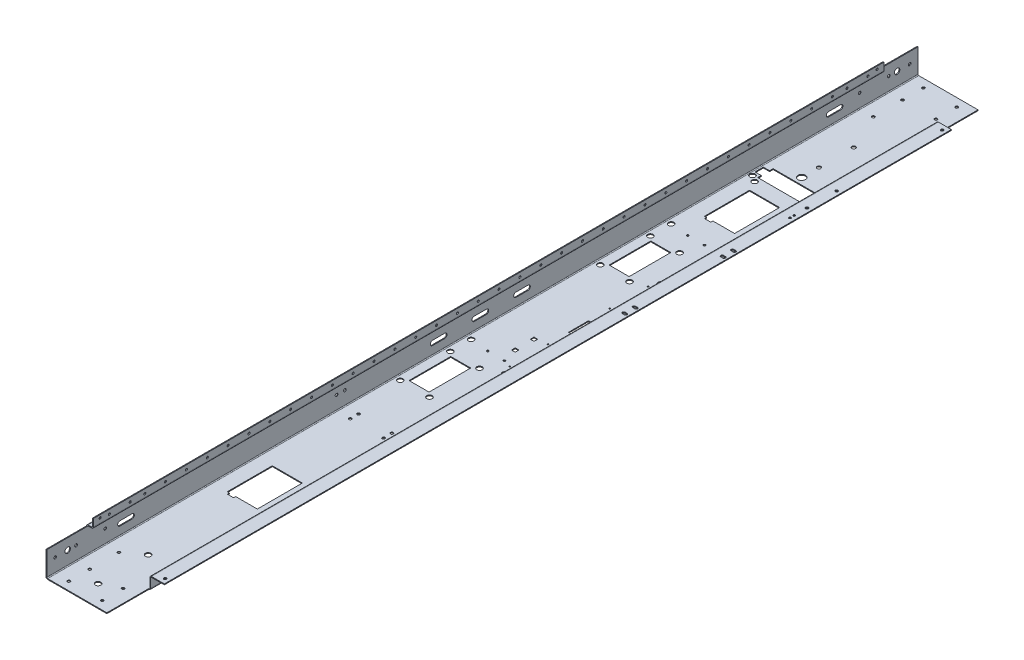
from build123d import *

# Parameters (mm, degrees)
SM_BASE_FLANGE_1_DEPTH    = 1045
SKETCH_6_W                = 101
SKETCH_6_H                = 30
CUT_EXTRUDE_1_DEPTH       = 37
SKETCH_7_W                = 17
SKETCH_7_H                = 97
CUT_EXTRUDE_2_DEPTH       = 24
SKETCH_8_R                = 6.5
SKETCH_8_R_2              = 3.25
CUT_EXTRUDE_3_DEPTH       = 10
SKETCH_9_R                = 3.25
CUT_EXTRUDE_4_DEPTH       = 10
SKETCH_13_R               = 3.25
CUT_EXTRUDE_6_DEPTH       = 10
CUT_EXTRUDE_7_DEPTH       = 10
CUT_EXTRUDE_8_DEPTH       = 10
SKETCH_16_R               = 3.25
SKETCH_16_R_2             = 6.5
CUT_EXTRUDE_9_DEPTH       = 10
SKETCH_17_R               = 2.5
CUT_EXTRUDE_10_DEPTH      = 10
MOVE_BODY_1_OUTLINE_R     = 3.25
MOVE_BODY_1_DEPTH         = 2
MOVE_START                = -28
MOVE_BODY_1_2_OUTLINE_R   = 6.5
MOVE_BODY_1_2_OUTLINE_R_2 = 3.25
MOVE_BODY_1_2_DEPTH       = 2
MOVE_START_2              = -183
MOVE_BODY_1_3_OUTLINE_R   = 3.25
MOVE_BODY_1_3_DEPTH       = 2
MOVE_BODY_1_4_OUTLINE_R   = 6.5
MOVE_BODY_1_4_OUTLINE_R_2 = 3.25
MOVE_BODY_1_4_DEPTH       = 30
MOVE_BODY_1_5_OUTLINE_R   = 3.25
MOVE_BODY_1_5_DEPTH       = 2
SKETCH_18_W               = 72
SKETCH_18_H               = 108
SKETCH_18_W_2             = 15
SKETCH_18_H_2             = 5
CUT_EXTRUDE_6828_DEPTH    = 10
SKETCH_21_R               = 6.5
CUT_EXTRUDE_7582_DEPTH    = 10
SKETCH_27_R               = 2.5
CUT_EXTRUDE_8046_DEPTH    = 10
SKETCH_32_R               = 6.5
SKETCH_32_W               = 48
SKETCH_32_H               = 100
CUT_EXTRUDE_9018_DEPTH    = 10
SKETCH_33_R               = 1.65
SKETCH_33_R_2             = 6.5
SKETCH_33_W               = 20
SKETCH_33_H               = 48
CUT_EXTRUDE_10405_DEPTH   = 10
SKETCH_34_W               = 9
SKETCH_34_H               = 9
CUT_EXTRUDE_10720_DEPTH   = 10
SKETCH_35_R               = 6.5
CUT_EXTRUDE_10935_DEPTH   = 10
SKETCH_36_R               = 4.5
SKETCH_36_R_2             = 9
CUT_EXTRUDE_11210_DEPTH   = 10
CUT_EXTRUDE_12065_DEPTH   = 10
SKETCH_38_R               = 2.5
CUT_EXTRUDE_12355_DEPTH   = 10


# Read off the part's stored shape, not the designer's step: Тело-Переместить/Копировать1
# Sheet-metal steps are written as plain solids
with BuildPart() as part:
    # Sketch 1 → Sm Base Flange 1 (new, symmetric)
    with BuildSketch(Plane.XY):
        with BuildLine():
            Line((0, 0), (-31, 0))
            ThreePointArc((-31, 0), (-32.414213562, -0.585786438), (-33, -2))
            Line((-33, -2), (-33, -24))
            ThreePointArc((-33, -24), (-34.171572875, -26.828427125), (-37, -28))
            Line((-37, -28), (-179, -28))
            ThreePointArc((-179, -28), (-181.828427125, -26.828427125), (-183, -24))
            Line((-183, -24), (-183, 33))
            ThreePointArc((-183, 33), (-181.828427125, 35.828427125), (-179, 37))
            Line((-179, 37), (-170, 37))
            ThreePointArc((-170, 37), (-168.585786438, 37.585786438), (-168, 39))
            Line((-168, 39), (-168, 57))
            Line((-168, 57), (-166, 57))
            Line((-166, 57), (-166, 39))
            ThreePointArc((-166, 39), (-167.171572875, 36.171572875), (-170, 35))
            Line((-170, 35), (-179, 35))
            ThreePointArc((-179, 35), (-180.414213562, 34.414213562), (-181, 33))
            Line((-181, 33), (-181, -24))
            ThreePointArc((-181, -24), (-180.414213562, -25.414213562), (-179, -26))
            Line((-179, -26), (-37, -26))
            ThreePointArc((-37, -26), (-35.585786438, -25.414213562), (-35, -24))
            Line((-35, -24), (-35, -2))
            ThreePointArc((-35, -2), (-33.828427125, 0.828427125), (-31, 2))
            Line((-31, 2), (0, 2))
            Line((0, 2), (0, 0))
        make_face()
    extrude(amount=SM_BASE_FLANGE_1_DEPTH, both=True)

    # Эскиз6 → Вырез-Вытянуть1 (cut)
    with BuildSketch(Plane(origin=(0, 0, 0), x_dir=(0, 0, -1), z_dir=(1, 0, 0))):
        with Locations((-994.5, -13)):
            Rectangle(SKETCH_6_W, SKETCH_6_H)
        with Locations((994.5, -13)):
            Rectangle(SKETCH_6_W, SKETCH_6_H)
    extrude(amount=-CUT_EXTRUDE_1_DEPTH, mode=Mode.SUBTRACT)

    # Эскиз7 → Вырез-Вытянуть2 (cut)
    with BuildSketch(Plane(origin=(0, 57, 0), x_dir=(1, 0, 0), z_dir=(0, 1, 0))):
        with Locations((-174.5, -996.5)):
            Rectangle(SKETCH_7_W, SKETCH_7_H)
        with Locations((-174.5, 996.5)):
            Rectangle(SKETCH_7_W, SKETCH_7_H)
    extrude(amount=-CUT_EXTRUDE_2_DEPTH, mode=Mode.SUBTRACT)

    # Эскиз8 → Вырез-Вытянуть3 (cut)
    with BuildSketch(Plane(origin=(0, -26, 0), x_dir=(1, 0, 0), z_dir=(0, 1, 0))):
        with Locations(Location((-108, 995, 0), (0, 0, 180))):
            Circle(SKETCH_8_R)
        with Locations(Location((-68, 1025, 0), (0, 0, 180))):
            Circle(SKETCH_8_R_2)
        with Locations(Location((-148, 1025, 0), (0, 0, 180))):
            Circle(SKETCH_8_R_2)
        with Locations(Location((-148, 975, 0), (0, 0, 180))):
            Circle(SKETCH_8_R_2)
        with Locations(Location((-68, 975, 0), (0, 0, 180))):
            Circle(SKETCH_8_R_2)
        with Locations(Location((-148, 905, 0), (0, 0, 180))):
            Circle(SKETCH_8_R_2)
        with Locations((-148, -905)):
            Circle(SKETCH_8_R_2)
        with Locations((-148, -1025)):
            Circle(SKETCH_8_R_2)
        with Locations((-148, -975)):
            Circle(SKETCH_8_R_2)
        with Locations((-68, -975)):
            Circle(SKETCH_8_R_2)
        with Locations((-68, -1025)):
            Circle(SKETCH_8_R_2)
    extrude(amount=-CUT_EXTRUDE_3_DEPTH, mode=Mode.SUBTRACT)

    # Эскиз9 → Вырез-Вытянуть4 (cut)
    with BuildSketch(Plane(origin=(0, -26, 0), x_dir=(1, 0, 0), z_dir=(0, 1, 0))):
        with Locations(Location((-68, 350, 0), (0, 0, 180))):
            Circle(SKETCH_9_R)
        with Locations(Location((-148, 350, 0), (0, 0, 180))):
            Circle(SKETCH_9_R)
        with Locations(Location((-148, 330, 0), (0, 0, 180))):
            Circle(SKETCH_9_R)
        with Locations(Location((-68, 330, 0), (0, 0, 180))):
            Circle(SKETCH_9_R)
    cut_extrude_4 = extrude(amount=-CUT_EXTRUDE_4_DEPTH, mode=Mode.SUBTRACT)

    # Зеркальное отражение1: Вырез-Вытянуть4 across plane
    add(cut_extrude_4.mirror(Plane(origin=(-77.5, 77.5, 0), x_dir=(0, 0, 1), z_dir=(-0.7071067811865476, 0.7071067811865475, 0))), mode=Mode.SUBTRACT)

    # Эскиз13 → Вырез-Вытянуть6 (cut)
    with BuildSketch(Plane.XZ):
        with Locations(Location((-10, -932, 0), (0, 0, 270))):
            Circle(SKETCH_13_R)
        with Locations(Location((-10, 932, 0), (0, 0, 270))):
            Circle(SKETCH_13_R)
        with Locations(Location((-10, 679, 0), (0, 0, 270))):
            Circle(SKETCH_13_R)
        with Locations(Location((-10, 608, 0), (0, 0, 270))):
            Circle(SKETCH_13_R)
    extrude(amount=-CUT_EXTRUDE_6_DEPTH, mode=Mode.SUBTRACT)

    # Эскиз14 → Вырез-Вытянуть7 (cut)
    with BuildSketch(Plane.XZ):
        with BuildLine():
            Line((-12, 434.25), (-7, 434.25))
            ThreePointArc((-7, 434.25), (-3.75, 431), (-7, 427.75))
            Line((-7, 427.75), (-12, 427.75))
            ThreePointArc((-12, 427.75), (-15.25, 431), (-12, 434.25))
        make_face()
        with BuildLine():
            Line((-12, 409.25), (-7, 409.25))
            ThreePointArc((-7, 409.25), (-3.75, 406), (-7, 402.75))
            Line((-7, 402.75), (-12, 402.75))
            ThreePointArc((-12, 402.75), (-15.25, 406), (-12, 409.25))
        make_face()
        with BuildLine():
            Line((-12, 198.25), (-7, 198.25))
            ThreePointArc((-7, 198.25), (-3.75, 195), (-7, 191.75))
            Line((-7, 191.75), (-12, 191.75))
            ThreePointArc((-12, 191.75), (-15.25, 195), (-12, 198.25))
        make_face()
        with BuildLine():
            Line((-12, 173.25), (-7, 173.25))
            ThreePointArc((-7, 173.25), (-3.75, 170), (-7, 166.75))
            Line((-7, 166.75), (-12, 166.75))
            ThreePointArc((-12, 166.75), (-15.25, 170), (-12, 173.25))
        make_face()
    extrude(amount=-CUT_EXTRUDE_7_DEPTH, mode=Mode.SUBTRACT)

    # Эскиз15 → Вырез-Вытянуть8 (cut)
    with BuildSketch(Plane.ZY.offset(183)):
        with BuildLine():
            Line((-869.5, 5.5), (-840.5, 5.5))
            ThreePointArc((-840.5, 5.5), (-835, 0), (-840.5, -5.5))
            Line((-840.5, -5.5), (-869.5, -5.5))
            ThreePointArc((-869.5, -5.5), (-875, 0), (-869.5, 5.5))
        make_face()
        with BuildLine():
            Line((-90.5, -5.5), (-119.5, -5.5))
            ThreePointArc((-119.5, -5.5), (-125, 0), (-119.5, 5.5))
            Line((-119.5, 5.5), (-90.5, 5.5))
            ThreePointArc((-90.5, 5.5), (-85, 0), (-90.5, -5.5))
        make_face()
        with BuildLine():
            Line((9.5, -5.5), (-19.5, -5.5))
            ThreePointArc((-19.5, -5.5), (-25, 0), (-19.5, 5.5))
            Line((-19.5, 5.5), (9.5, 5.5))
            ThreePointArc((9.5, 5.5), (15, 0), (9.5, -5.5))
        make_face()
        with BuildLine():
            Line((109.5, -5.5), (80.5, -5.5))
            ThreePointArc((80.5, -5.5), (75, 0), (80.5, 5.5))
            Line((80.5, 5.5), (109.5, 5.5))
            ThreePointArc((109.5, 5.5), (115, 0), (109.5, -5.5))
        make_face()
        with BuildLine():
            Line((859.5, -5.5), (830.5, -5.5))
            ThreePointArc((830.5, -5.5), (825, 0), (830.5, 5.5))
            Line((830.5, 5.5), (859.5, 5.5))
            ThreePointArc((859.5, 5.5), (865, 0), (859.5, -5.5))
        make_face()
    extrude(amount=-CUT_EXTRUDE_8_DEPTH, mode=Mode.SUBTRACT)

    # Эскиз16 → Вырез-Вытянуть9 (cut)
    with BuildSketch(Plane.ZY.offset(183)):
        with Locations((1025, 7)):
            Circle(SKETCH_16_R)
        with Locations((995, 7)):
            Circle(SKETCH_16_R_2)
        with Locations((975, 7)):
            Circle(SKETCH_16_R)
        with Locations((905, 7)):
            Circle(SKETCH_16_R)
        with Locations(Location((-905, 7, 0), (0, 0, 180))):
            Circle(SKETCH_16_R)
        with Locations(Location((-975, 7, 0), (0, 0, 180))):
            Circle(SKETCH_16_R)
        with Locations(Location((-995, 7, 0), (0, 0, 180))):
            Circle(SKETCH_16_R_2)
        with Locations(Location((-1025, 7, 0), (0, 0, 180))):
            Circle(SKETCH_16_R)
    extrude(amount=-CUT_EXTRUDE_9_DEPTH, mode=Mode.SUBTRACT)

    # Эскиз17 → Вырез-Вытянуть10 (cut)
    with BuildSketch(Plane.ZY.offset(168)):
        with Locations((910, 47)):
            Circle(SKETCH_17_R)
        with Locations((860, 47)):
            Circle(SKETCH_17_R)
        with Locations((825, 47)):
            Circle(SKETCH_17_R)
        with Locations((-860, 47)):
            Circle(SKETCH_17_R)
        with Locations((-910, 47)):
            Circle(SKETCH_17_R)
        with Locations((-932, 50)):
            Circle(SKETCH_17_R)
        with Locations((932, 50)):
            Circle(SKETCH_17_R)
        with Locations((775, 47)):
            Circle(SKETCH_17_R)
        with Locations((725, 47)):
            Circle(SKETCH_17_R)
        with Locations((675, 47)):
            Circle(SKETCH_17_R)
        with Locations((625, 47)):
            Circle(SKETCH_17_R)
        with Locations((575, 47)):
            Circle(SKETCH_17_R)
        with Locations((525, 47)):
            Circle(SKETCH_17_R)
        with Locations((475, 47)):
            Circle(SKETCH_17_R)
        with Locations((425, 47)):
            Circle(SKETCH_17_R)
        with Locations((375, 47)):
            Circle(SKETCH_17_R)
        with Locations((325, 47)):
            Circle(SKETCH_17_R)
        with Locations((275, 47)):
            Circle(SKETCH_17_R)
        with Locations((225, 47)):
            Circle(SKETCH_17_R)
        with Locations((175, 47)):
            Circle(SKETCH_17_R)
        with Locations((125, 47)):
            Circle(SKETCH_17_R)
        with Locations((75, 47)):
            Circle(SKETCH_17_R)
        with Locations((25, 47)):
            Circle(SKETCH_17_R)
        with Locations((-25, 47)):
            Circle(SKETCH_17_R)
        with Locations((-75, 47)):
            Circle(SKETCH_17_R)
        with Locations((-125, 47)):
            Circle(SKETCH_17_R)
        with Locations((-175, 47)):
            Circle(SKETCH_17_R)
        with Locations((-225, 47)):
            Circle(SKETCH_17_R)
        with Locations((-275, 47)):
            Circle(SKETCH_17_R)
        with Locations((-325, 47)):
            Circle(SKETCH_17_R)
        with Locations((-375, 47)):
            Circle(SKETCH_17_R)
        with Locations((-425, 47)):
            Circle(SKETCH_17_R)
        with Locations((-475, 47)):
            Circle(SKETCH_17_R)
        with Locations((-525, 47)):
            Circle(SKETCH_17_R)
        with Locations((-575, 47)):
            Circle(SKETCH_17_R)
        with Locations((-625, 47)):
            Circle(SKETCH_17_R)
        with Locations((-675, 47)):
            Circle(SKETCH_17_R)
        with Locations((-725, 47)):
            Circle(SKETCH_17_R)
        with Locations((-775, 47)):
            Circle(SKETCH_17_R)
        with Locations((-825, 47)):
            Circle(SKETCH_17_R)
    extrude(amount=-CUT_EXTRUDE_10_DEPTH, mode=Mode.SUBTRACT)

    # Move Body 1 outline → Move Body 1 (add)
    with BuildSketch(Plane(origin=(0, 0, 0), x_dir=(1, 0, 0), z_dir=(0, 1, 0))):
        with Locations((-10, -608)):
            Circle(MOVE_BODY_1_OUTLINE_R)
        with Locations((-10, -679)):
            Circle(MOVE_BODY_1_OUTLINE_R)
        with BuildLine():
            ThreePointArc((-12, -166.75), (-15.25, -170), (-12, -173.25))
            Line((-12, -173.25), (-7, -173.25))
            ThreePointArc((-7, -173.25), (-3.75, -170), (-7, -166.75))
            Line((-7, -166.75), (-12, -166.75))
        make_face()
        with BuildLine():
            ThreePointArc((-12, -191.75), (-15.25, -195), (-12, -198.25))
            Line((-12, -198.25), (-7, -198.25))
            ThreePointArc((-7, -198.25), (-3.75, -195), (-7, -191.75))
            Line((-7, -191.75), (-12, -191.75))
        make_face()
        with BuildLine():
            ThreePointArc((-12, -402.75), (-15.25, -406), (-12, -409.25))
            Line((-12, -409.25), (-7, -409.25))
            ThreePointArc((-7, -409.25), (-3.75, -406), (-7, -402.75))
            Line((-7, -402.75), (-12, -402.75))
        make_face()
        with BuildLine():
            ThreePointArc((-12, -427.75), (-15.25, -431), (-12, -434.25))
            Line((-12, -434.25), (-7, -434.25))
            ThreePointArc((-7, -434.25), (-3.75, -431), (-7, -427.75))
            Line((-7, -427.75), (-12, -427.75))
        make_face()
    extrude(amount=MOVE_BODY_1_DEPTH)

    # Move Body 1 2 outline → Move Body 1 2 (add)
    with BuildSketch(Plane(origin=(0, 0, 0), x_dir=(1, 0, 0), z_dir=(0, 1, 0)).offset(MOVE_START)):
        with Locations((-108, 995)):
            Circle(MOVE_BODY_1_2_OUTLINE_R)
        with Locations((-68, 350)):
            Circle(MOVE_BODY_1_2_OUTLINE_R_2)
        with Locations((-148, 350)):
            Circle(MOVE_BODY_1_2_OUTLINE_R_2)
        with Locations((-148, 330)):
            Circle(MOVE_BODY_1_2_OUTLINE_R_2)
        with Locations((-68, 330)):
            Circle(MOVE_BODY_1_2_OUTLINE_R_2)
    extrude(amount=MOVE_BODY_1_2_DEPTH)

    # Move Body 1 3 outline → Move Body 1 3 (add)
    with BuildSketch(Plane.YZ.offset(MOVE_START_2)):
        with BuildLine():
            Line((5.5, -869.5), (5.5, -859.5))
            ThreePointArc((5.5, -859.5), (0, -865), (-5.5, -859.5))
            Line((-5.5, -859.5), (-5.5, -869.5))
            ThreePointArc((-5.5, -869.5), (0, -875), (5.5, -869.5))
        make_face()
        with BuildLine():
            Line((5.5, -119.5), (5.5, -109.5))
            ThreePointArc((5.5, -109.5), (0, -115), (-5.5, -109.5))
            Line((-5.5, -109.5), (-5.5, -119.5))
            ThreePointArc((-5.5, -119.5), (0, -125), (5.5, -119.5))
        make_face()
        with BuildLine():
            Line((5.5, -19.5), (5.5, -9.5))
            ThreePointArc((5.5, -9.5), (0, -15), (-5.5, -9.5))
            Line((-5.5, -9.5), (-5.5, -19.5))
            ThreePointArc((-5.5, -19.5), (0, -25), (5.5, -19.5))
        make_face()
        with BuildLine():
            Line((5.5, 80.5), (5.5, 90.5))
            ThreePointArc((5.5, 90.5), (0, 85), (-5.5, 90.5))
            Line((-5.5, 90.5), (-5.5, 80.5))
            ThreePointArc((-5.5, 80.5), (0, 75), (5.5, 80.5))
        make_face()
        with BuildLine():
            ThreePointArc((5.5, 840.5), (0, 835), (-5.5, 840.5))
            Line((-5.5, 840.5), (-5.5, 830.5))
            ThreePointArc((-5.5, 830.5), (0, 825), (5.5, 830.5))
            Line((5.5, 830.5), (5.5, 840.5))
        make_face()
        with Locations((7, -350)):
            Circle(MOVE_BODY_1_3_OUTLINE_R)
        with Locations((7, -330)):
            Circle(MOVE_BODY_1_3_OUTLINE_R)
    extrude(amount=MOVE_BODY_1_3_DEPTH)

    # Move Body 1 4 outline → Move Body 1 4 (cut)
    with BuildSketch(Plane(origin=(0, 0, 0), x_dir=(1, 0, 0), z_dir=(0, 1, 0)).offset(MOVE_START)):
        with Locations((-108, -995)):
            Circle(MOVE_BODY_1_4_OUTLINE_R)
        with Locations((-68, -350)):
            Circle(MOVE_BODY_1_4_OUTLINE_R_2)
        with Locations((-148, -350)):
            Circle(MOVE_BODY_1_4_OUTLINE_R_2)
        with Locations((-148, -330)):
            Circle(MOVE_BODY_1_4_OUTLINE_R_2)
        with Locations((-68, -330)):
            Circle(MOVE_BODY_1_4_OUTLINE_R_2)
        with Locations((-10, 608)):
            Circle(MOVE_BODY_1_4_OUTLINE_R_2)
        with Locations((-10, 679)):
            Circle(MOVE_BODY_1_4_OUTLINE_R_2)
        with BuildLine():
            ThreePointArc((-12, 173.25), (-15.25, 170), (-12, 166.75))
            Line((-12, 166.75), (-7, 166.75))
            ThreePointArc((-7, 166.75), (-3.75, 170), (-7, 173.25))
            Line((-7, 173.25), (-12, 173.25))
        make_face()
        with BuildLine():
            ThreePointArc((-12, 198.25), (-15.25, 195), (-12, 191.75))
            Line((-12, 191.75), (-7, 191.75))
            ThreePointArc((-7, 191.75), (-3.75, 195), (-7, 198.25))
            Line((-7, 198.25), (-12, 198.25))
        make_face()
        with BuildLine():
            ThreePointArc((-12, 409.25), (-15.25, 406), (-12, 402.75))
            Line((-12, 402.75), (-7, 402.75))
            ThreePointArc((-7, 402.75), (-3.75, 406), (-7, 409.25))
            Line((-7, 409.25), (-12, 409.25))
        make_face()
        with BuildLine():
            ThreePointArc((-12, 434.25), (-15.25, 431), (-12, 427.75))
            Line((-12, 427.75), (-7, 427.75))
            ThreePointArc((-7, 427.75), (-3.75, 431), (-7, 434.25))
            Line((-7, 434.25), (-12, 434.25))
        make_face()
    extrude(amount=MOVE_BODY_1_4_DEPTH, mode=Mode.SUBTRACT)

    # Move Body 1 5 outline → Move Body 1 5 (cut)
    with BuildSketch(Plane.YZ.offset(MOVE_START_2)):
        with Locations((7, 350)):
            Circle(MOVE_BODY_1_5_OUTLINE_R)
        with Locations((7, 330)):
            Circle(MOVE_BODY_1_5_OUTLINE_R)
        with BuildLine():
            ThreePointArc((-5.5, -840.5), (0, -835), (5.5, -840.5))
            Line((5.5, -840.5), (5.5, -830.5))
            ThreePointArc((5.5, -830.5), (0, -825), (-5.5, -830.5))
            Line((-5.5, -830.5), (-5.5, -840.5))
        make_face()
        with BuildLine():
            ThreePointArc((-5.5, -90.5), (0, -85), (5.5, -90.5))
            Line((5.5, -90.5), (5.5, -80.5))
            ThreePointArc((5.5, -80.5), (0, -75), (-5.5, -80.5))
            Line((-5.5, -80.5), (-5.5, -90.5))
        make_face()
        with BuildLine():
            ThreePointArc((-5.5, 9.5), (0, 15), (5.5, 9.5))
            Line((5.5, 9.5), (5.5, 19.5))
            ThreePointArc((5.5, 19.5), (0, 25), (-5.5, 19.5))
            Line((-5.5, 19.5), (-5.5, 9.5))
        make_face()
        with BuildLine():
            ThreePointArc((-5.5, 109.5), (0, 115), (5.5, 109.5))
            Line((5.5, 109.5), (5.5, 119.5))
            ThreePointArc((5.5, 119.5), (0, 125), (-5.5, 119.5))
            Line((-5.5, 119.5), (-5.5, 109.5))
        make_face()
        with BuildLine():
            ThreePointArc((5.5, 869.5), (0, 875), (-5.5, 869.5))
            Line((-5.5, 869.5), (-5.5, 859.5))
            ThreePointArc((-5.5, 859.5), (0, 865), (5.5, 859.5))
            Line((5.5, 859.5), (5.5, 869.5))
        make_face()
    extrude(amount=MOVE_BODY_1_5_DEPTH, mode=Mode.SUBTRACT)

    # Эскиз18 → Cut-Extrude 6828 (cut)
    with BuildSketch(Plane.XZ.offset(28)):
        with Locations((-108, 595)):
            Rectangle(SKETCH_18_W, SKETCH_18_H)
        with Locations((-108, -550)):
            Rectangle(SKETCH_18_W, SKETCH_18_H)
        with Locations((-131.5, 651.5)):
            Rectangle(SKETCH_18_W_2, SKETCH_18_H_2)
        with Locations((-131.5, -493.5)):
            Rectangle(SKETCH_18_W_2, SKETCH_18_H_2)
    extrude(amount=-CUT_EXTRUDE_6828_DEPTH, mode=Mode.SUBTRACT)

    # Эскиз21 → Cut-Extrude 7582 (cut)
    with BuildSketch(Plane.XZ.offset(28)):
        with Locations((-108, 875)):
            Circle(SKETCH_21_R)
    extrude(amount=-CUT_EXTRUDE_7582_DEPTH, mode=Mode.SUBTRACT)

    # Эскиз27 → Cut-Extrude 8046 (cut)
    with BuildSketch(Plane(origin=(0, 2, 0), x_dir=(1, 0, 0), z_dir=(0, 1, 0))):
        with Locations(Location((-10, 567, 0), (0, 0, 270))):
            Circle(SKETCH_27_R)
        with Locations(Location((-10, 577, 0), (0, 0, 270))):
            Circle(SKETCH_27_R)
    extrude(amount=-CUT_EXTRUDE_8046_DEPTH, mode=Mode.SUBTRACT)

    # Эскиз32 → Cut-Extrude 9018 (cut)
    with BuildSketch(Plane.XZ.offset(28)):
        with Locations((-98, 210)):
            Circle(SKETCH_32_R)
        with Locations((-168, 210)):
            Circle(SKETCH_32_R)
        with Locations((-168, 90)):
            Circle(SKETCH_32_R)
        with Locations((-98, 90)):
            Circle(SKETCH_32_R)
        with Locations((-168, 40)):
            Circle(SKETCH_32_R)
        with Locations((-98, -270)):
            Circle(SKETCH_32_R)
        with Locations((-168, -270)):
            Circle(SKETCH_32_R)
        with Locations((-168, -390)):
            Circle(SKETCH_32_R)
        with Locations((-98, -390)):
            Circle(SKETCH_32_R)
        with Locations((-168, -440)):
            Circle(SKETCH_32_R)
        with Locations((-133, 150)):
            Rectangle(SKETCH_32_W, SKETCH_32_H)
        with Locations((-133, -330)):
            Rectangle(SKETCH_32_W, SKETCH_32_H)
    extrude(amount=-CUT_EXTRUDE_9018_DEPTH, mode=Mode.SUBTRACT)

    # Эскиз33 → Cut-Extrude 10405 (cut)
    with BuildSketch(Plane.XZ.offset(28)):
        with Locations((-56, -150.6)):
            Circle(SKETCH_33_R)
        with Locations((-56, -80.6)):
            Circle(SKETCH_33_R)
        with Locations((-46.5, -190)):
            Circle(SKETCH_33_R)
        with Locations((-65.5, -190)):
            Circle(SKETCH_33_R)
        with Locations((-46.5, -282)):
            Circle(SKETCH_33_R)
        with Locations((-65.5, -282)):
            Circle(SKETCH_33_R)
        with Locations((-56, -303)):
            Circle(SKETCH_33_R_2)
        with Locations((-857.445331284, -65.855615433)):
            Circle(SKETCH_33_R)
        with Locations((-857.445331284, 4.144384567)):
            Circle(SKETCH_33_R)
        with Locations((-847.945331284, -95.855615433)):
            Circle(SKETCH_33_R)
        with Locations((-866.945331284, -95.855615433)):
            Circle(SKETCH_33_R)
        with Locations((-847.945331284, -188.855615433)):
            Circle(SKETCH_33_R)
        with Locations((-866.945331284, -188.855615433)):
            Circle(SKETCH_33_R)
        with Locations((-857.445331284, -208.855615433)):
            Circle(SKETCH_33_R_2)
        with Locations(Location((-56, 70.8, 0), (0, 0, 180))):
            Circle(SKETCH_33_R_2)
        with Locations(Location((-65.5, 49.8, 0), (0, 0, 180))):
            Circle(SKETCH_33_R)
        with Locations(Location((-46.5, 49.8, 0), (0, 0, 180))):
            Circle(SKETCH_33_R)
        with Locations(Location((-65.5, -42.2, 0), (0, 0, 180))):
            Circle(SKETCH_33_R)
        with Locations(Location((-46.5, -42.2, 0), (0, 0, 180))):
            Circle(SKETCH_33_R)
        with Locations((-56, -115.6)):
            Rectangle(SKETCH_33_W, SKETCH_33_H)
        with Locations((-857.445331284, -30.855615433)):
            Rectangle(SKETCH_33_W, SKETCH_33_H)
    extrude(amount=-CUT_EXTRUDE_10405_DEPTH, mode=Mode.SUBTRACT)

    # Эскиз34 → Cut-Extrude 10720 (cut)
    with BuildSketch(Plane.XZ.offset(28)):
        with Locations((-93, 9.25)):
            Rectangle(SKETCH_34_W, SKETCH_34_H)
        with Locations((-93, -35.75)):
            Rectangle(SKETCH_34_W, SKETCH_34_H)
    extrude(amount=-CUT_EXTRUDE_10720_DEPTH, mode=Mode.SUBTRACT)

    # Эскиз35 → Cut-Extrude 10935 (cut)
    with BuildSketch(Plane.XZ.offset(28)):
        with Locations((-171, -638)):
            Circle(SKETCH_35_R)
        with Locations((-156, -628)):
            Circle(SKETCH_35_R)
    extrude(amount=-CUT_EXTRUDE_10935_DEPTH, mode=Mode.SUBTRACT)

    # Эскиз36 → Cut-Extrude 11210 (cut)
    with BuildSketch(Plane.XZ.offset(28)):
        with Locations((-108, -818)):
            Circle(SKETCH_36_R)
        with Locations((-108, -734.5)):
            Circle(SKETCH_36_R)
        with Locations((-108, -693)):
            Circle(SKETCH_36_R_2)
    extrude(amount=-CUT_EXTRUDE_11210_DEPTH, mode=Mode.SUBTRACT)

    # Эскиз37 → Cut-Extrude 12065 (cut)
    with BuildSketch(Plane.XZ.offset(28)):
        Polygon((-55.5, -677), (-160.5, -677), (-160.5, -668.5), (-175.5, -668.5), (-175.5, -648.5), (-160.5, -648.5), (-160.5, -640), (-55.5, -640), (-55.5, -648.5), (-40.5, -648.5), (-40.5, -668.5), (-55.5, -668.5), align=None)
    extrude(amount=-CUT_EXTRUDE_12065_DEPTH, mode=Mode.SUBTRACT)

    # Эскиз38 → Cut-Extrude 12355 (cut)
    with BuildSketch(Plane.XZ.offset(28)):
        with Locations((-84, 44.25)):
            Circle(SKETCH_38_R)
        with Locations((-124, 44.25)):
            Circle(SKETCH_38_R)
        with Locations((-84, -435.75)):
            Circle(SKETCH_38_R)
        with Locations((-124, -435.75)):
            Circle(SKETCH_38_R)
    extrude(amount=-CUT_EXTRUDE_12355_DEPTH, mode=Mode.SUBTRACT)


solid = part.part
